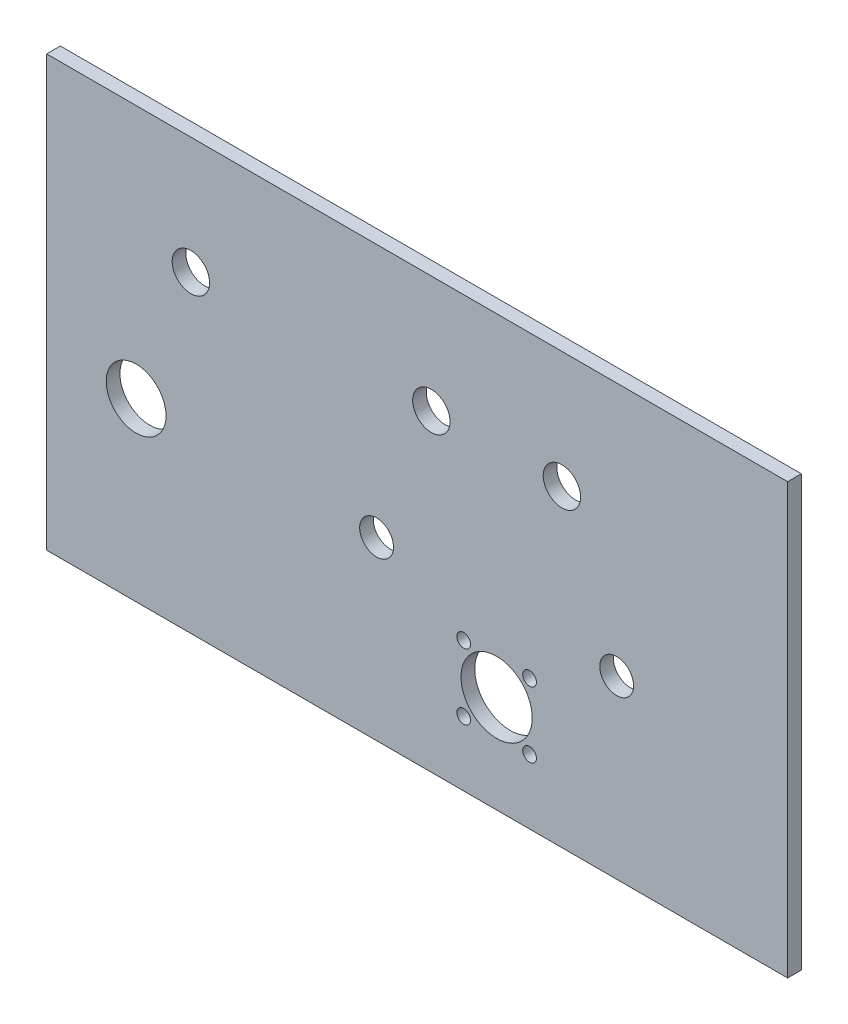
from build123d import *

# Parameters (mm, degrees)
SKETCH_1_W      = 270.571276656
SKETCH_1_H      = 156.946778824
SKETCH_1_R      = 13
SKETCH_1_R_2    = 2.5
SKETCH_1_R_3    = 6.183267946
SKETCH_1_R_4    = 10.921995269
SKETCH_1_R_5    = 6.826247043
EXTRUDE_1_DEPTH = 5


with BuildPart() as part:
    # Эскиз1 → Бобышка-Вытянуть1 (new body)
    with BuildSketch(Plane.XY):
        with Locations((-29.02181407, 42.854480689)):
            Rectangle(SKETCH_1_W, SKETCH_1_H)
        Circle(SKETCH_1_R, mode=Mode.SUBTRACT)
        with Locations((-12.02081528, 12.02081528)):
            Circle(SKETCH_1_R_2, mode=Mode.SUBTRACT)
        with Locations((12.02081528, 12.02081528)):
            Circle(SKETCH_1_R_2, mode=Mode.SUBTRACT)
        with Locations((12.02081528, -12.02081528)):
            Circle(SKETCH_1_R_2, mode=Mode.SUBTRACT)
        with Locations((-12.02081528, -12.02081528)):
            Circle(SKETCH_1_R_2, mode=Mode.SUBTRACT)
        with Locations((-43.833789907, 28.652608569)):
            Circle(SKETCH_1_R_3, mode=Mode.SUBTRACT)
        with Locations((43.833789907, 28.652608569)):
            Circle(SKETCH_1_R_3, mode=Mode.SUBTRACT)
        with Locations((-131.643066792, 28.652608569)):
            Circle(SKETCH_1_R_4, mode=Mode.SUBTRACT)
        with Locations((-23.833789907, 78.652608569)):
            Circle(SKETCH_1_R_5, mode=Mode.SUBTRACT)
        with Locations((23.833789907, 78.652608569)):
            Circle(SKETCH_1_R_5, mode=Mode.SUBTRACT)
        with Locations((-111.643066792, 78.652608569)):
            Circle(SKETCH_1_R_5, mode=Mode.SUBTRACT)
    extrude(amount=EXTRUDE_1_DEPTH)


solid = part.part
